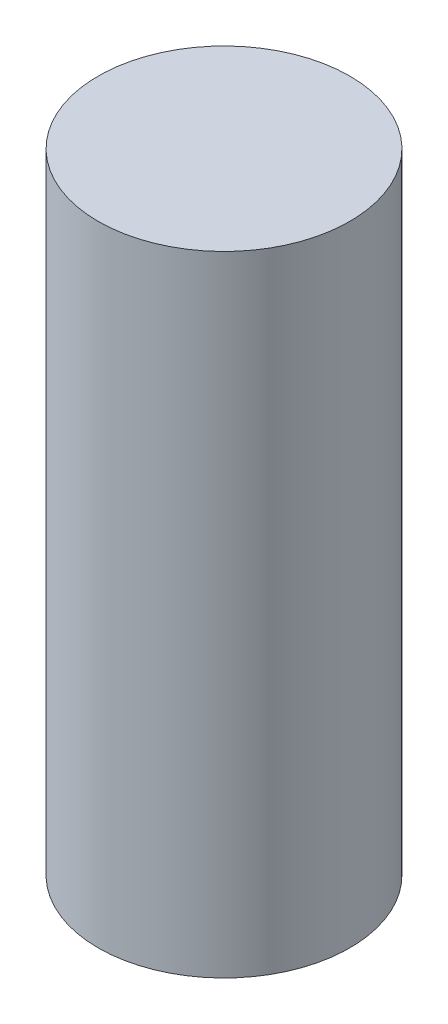
from build123d import *

# Parameters (mm, degrees)
SKETCH2_R           = 30
BOSS_EXTRUDE1_DEPTH = 150
CUT_EXTRUDE1_DEPTH  = 100


with BuildPart() as part:
    # Sketch2 → Boss-Extrude1 (new body)
    with BuildSketch(Plane(origin=(0, 0, 0), x_dir=(1, 0, 0), z_dir=(0, 1, 0))):
        Circle(SKETCH2_R)
    extrude(amount=BOSS_EXTRUDE1_DEPTH)

    # Sketch3 → Cut-Extrude1 (cut)
    with BuildSketch(Plane(origin=(0, 0, 0), x_dir=(0, 0, -1), z_dir=(1, 0, 0))):
        with BuildLine():
            ThreePointArc((0, 30), (14.142135624, 35.857864376), (20, 50))
            ThreePointArc((20, 50), (-14.142135624, 64.142135624), (0, 30))
        make_face()
    extrude(amount=-CUT_EXTRUDE1_DEPTH, mode=Mode.SUBTRACT)


solid = part.part
